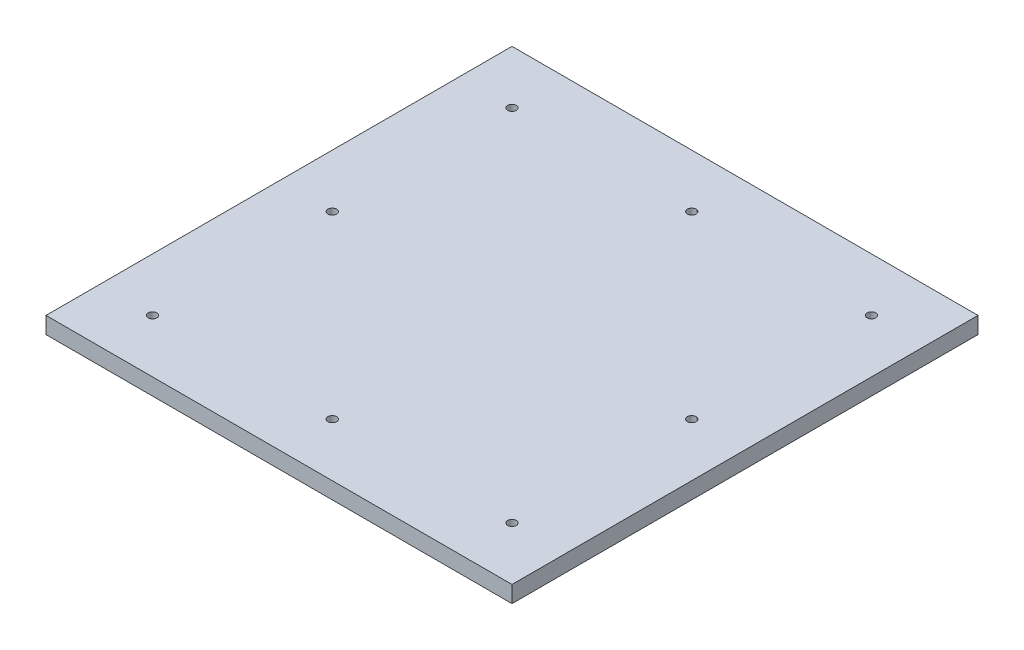
from build123d import *

# Parameters (mm, degrees)
SKETCH1_W           = 177.8
SKETCH1_H           = 177.8
SKETCH1_R           = 1.6637
BOSS_EXTRUDE1_DEPTH = 6.35


with BuildPart() as part:
    # Sketch1 → Boss-Extrude1 (new body)
    with BuildSketch(Plane(origin=(0, 0, 0), x_dir=(1, 0, 0), z_dir=(0, 1, 0))):
        with Locations((88.9, 88.9)):
            Rectangle(SKETCH1_W, SKETCH1_H)
        with Locations((20.32, 157.48)):
            Circle(SKETCH1_R, mode=Mode.SUBTRACT)
        with Locations((88.9, 157.48)):
            Circle(SKETCH1_R, mode=Mode.SUBTRACT)
        with Locations((157.48, 157.48)):
            Circle(SKETCH1_R, mode=Mode.SUBTRACT)
        with Locations((20.32, 88.9)):
            Circle(SKETCH1_R, mode=Mode.SUBTRACT)
        with Locations((20.32, 20.32)):
            Circle(SKETCH1_R, mode=Mode.SUBTRACT)
        with Locations((88.9, 20.32)):
            Circle(SKETCH1_R, mode=Mode.SUBTRACT)
        with Locations((157.48, 88.9)):
            Circle(SKETCH1_R, mode=Mode.SUBTRACT)
        with Locations((157.48, 20.32)):
            Circle(SKETCH1_R, mode=Mode.SUBTRACT)
    extrude(amount=BOSS_EXTRUDE1_DEPTH)


solid = part.part
